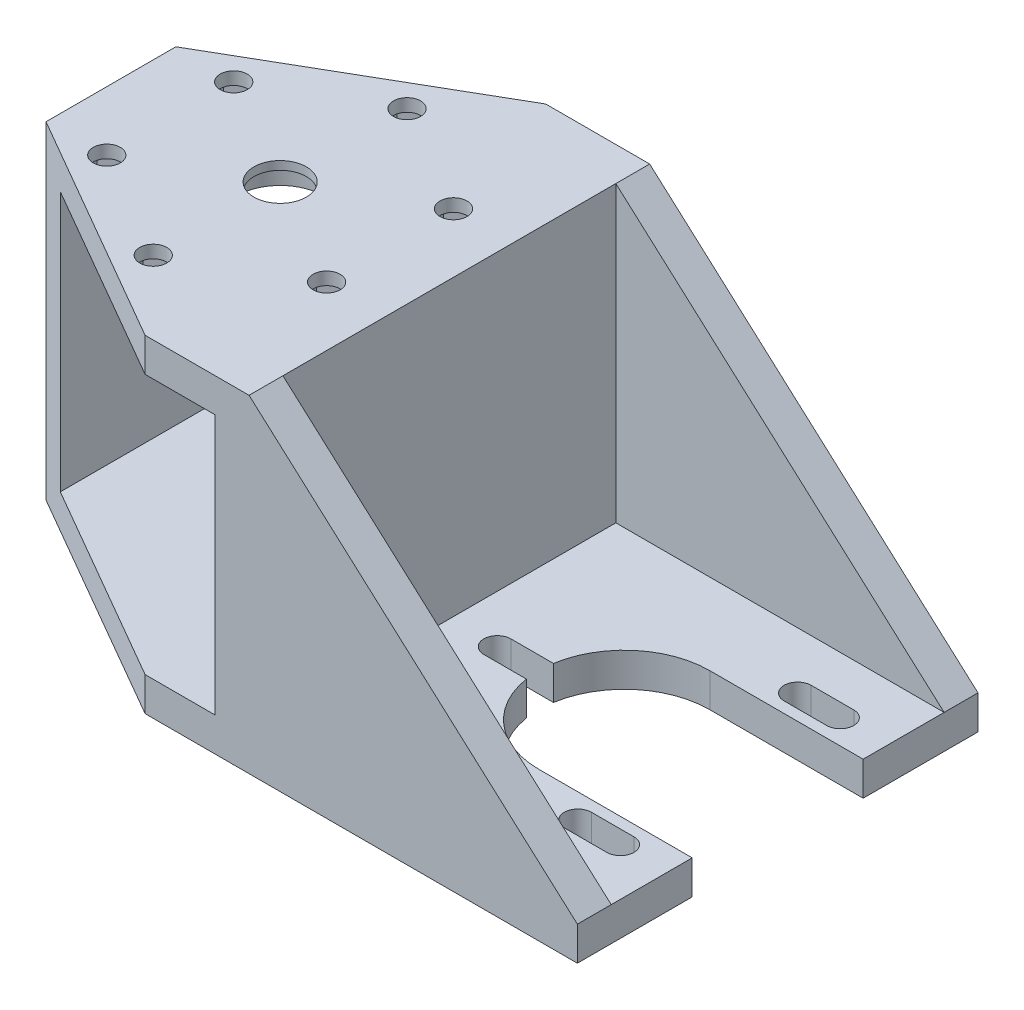
from build123d import *

# Parameters (mm, degrees)
BOSS_EXTRUDE1_DEPTH     = 39.35
CUT_EXTRUDE2_DEPTH      = 33.73
CUT_EXTRUDE2_DEPTH_BACK = 3
SKETCH3_R               = 5.15
CUT_EXTRUDE3_DEPTH      = 33.73
CUT_EXTRUDE4_DEPTH      = 87.647311883
CUT_EXTRUDE4_DEPTH_BACK = 87.647311883
SKETCH3_5_R             = 3.1
SKETCH3_5_R_2           = 10.1
SKETCH3_5_R_3           = 1.6
SKETCH3_5_W             = 20.675
SKETCH3_5_H             = 20.2
SKETCH3_5_W_2           = 5.027537917
SKETCH3_5_H_2           = 3.2
SKETCH3_5_W_3           = 5.03
SKETCH3_6_R             = 1.6
CUT_EXTRUDE5_DEPTH      = 87.647311883
BOSS_EXTRUDE2_DEPTH     = 4
BOSS_EXTRUDE3_DEPTH     = 4
CUT_EXTRUDE6_DEPTH      = 92.909209967
CUT_EXTRUDE6_DEPTH_BACK = 92.909209967
CUT_EXTRUDE7_DEPTH      = 2.5
SKETCH10_W              = 47.35
SKETCH10_H              = 38.73
BOSS_EXTRUDE5_DEPTH     = 4
CHAMFER3_SIZE           = 16
CHAMFER3_SIZE_2         = 27.712812921


with BuildPart() as part:
    # Sketch1 → Boss-Extrude1 (new body)
    with BuildSketch(Plane.XY):
        Polygon((-68.943174111, 38.106680783), (-32.943174111, 38.106680783), (-32.943174111, 3.376680783), (8.406825889, 3.376680783), (8.406825889, -0.623319217), (-68.943174111, -0.623319217), (-68.943174111, 3.376680783), (-36.943174111, 3.376680783), (-36.943174111, 34.106680783), (-68.943174111, 34.106680783), align=None)
    extrude(amount=BOSS_EXTRUDE1_DEPTH)

    # Sketch3 → Cut-Extrude2 (cut, two sides: drawn at the far end of the back side and taken through both)
    with BuildSketch(Plane(origin=(0, 3.376680783, 0), x_dir=(1, 0, 0), z_dir=(0, 1, 0)).offset(-CUT_EXTRUDE2_DEPTH_BACK)):
        with Locations(Location((-52.943174111, -19.675, 0), (0, 0, 90))):
            Circle(SKETCH3_R)
    extrude(amount=CUT_EXTRUDE2_DEPTH + CUT_EXTRUDE2_DEPTH_BACK, mode=Mode.SUBTRACT)

    # Sketch3<4> → Cut-Extrude3 (cut)
    with BuildSketch(Plane(origin=(0, 3.376680783, 0), x_dir=(1, 0, 0), z_dir=(0, 1, 0))):
        with BuildLine():
            Line((-47.611429556, -21.025), (-45.3116605, -21.025))
            Line((-45.3116605, -21.025), (-45.3116605, -18.325))
            Line((-45.3116605, -18.325), (-47.611429556, -18.325))
            ThreePointArc((-47.611429556, -18.325), (-47.485400066, -18.994777629), (-47.443174111, -19.675))
            ThreePointArc((-47.443174111, -19.675), (-47.485400066, -20.355222371), (-47.611429556, -21.025))
        make_face()
        with BuildLine():
            Line((-60.574687722, -18.325), (-60.574687722, -21.025))
            Line((-60.574687722, -21.025), (-58.274918666, -21.025))
            ThreePointArc((-58.274918666, -21.025), (-58.443174111, -19.675), (-58.274918666, -18.325))
            Line((-58.274918666, -18.325), (-60.574687722, -18.325))
        make_face()
    extrude(amount=CUT_EXTRUDE3_DEPTH, mode=Mode.SUBTRACT)

    # Sketch3<5> → Cut-Extrude4 (cut, two sides: drawn at the far end of the back side and taken through both)
    with BuildSketch(Plane(origin=(0, 3.376680783, 0), x_dir=(1, 0, 0), z_dir=(0, 1, 0)).offset(-CUT_EXTRUDE4_DEPTH_BACK)):
        with Locations(Location((-52.943174111, -19.675, 0), (0, 0, 270))):
            Circle(SKETCH3_5_R)
        with Locations((-12.268174111, -19.675)):
            Circle(SKETCH3_5_R_2)
        with Locations((-4.768174111, -32.665381057)):
            Circle(SKETCH3_5_R_3)
        with Locations((-4.768174111, -6.684618943)):
            Circle(SKETCH3_5_R_3)
        with Locations((-27.268174111, -19.675)):
            Circle(SKETCH3_5_R_3)
        with Locations((0.261825889, -32.665381057)):
            Circle(SKETCH3_5_R_3)
        with Locations((0.261825889, -6.684618943)):
            Circle(SKETCH3_5_R_3)
        with Locations((-1.930674111, -19.675)):
            Rectangle(SKETCH3_5_W, SKETCH3_5_H)
        with Locations((-24.754405152, -19.675)):
            Rectangle(SKETCH3_5_W_2, SKETCH3_5_H_2)
        with Locations((-2.253174111, -32.665381057)):
            Rectangle(SKETCH3_5_W_3, SKETCH3_5_H_2)
        with Locations((-2.253174111, -6.684618943)):
            Rectangle(SKETCH3_5_W_3, SKETCH3_5_H_2)
    extrude(amount=CUT_EXTRUDE4_DEPTH + CUT_EXTRUDE4_DEPTH_BACK, mode=Mode.SUBTRACT)

    # Sketch3<6> → Cut-Extrude5 (cut, through all)
    with BuildSketch(Plane(origin=(0, 3.376680783, 0), x_dir=(1, 0, 0), z_dir=(0, 1, 0))):
        with Locations(Location((-52.943174111, -34.675, 0), (0, 0, 180))):
            Circle(SKETCH3_6_R)
        with Locations(Location((-65.933555168, -27.175, 0), (0, 0, 180))):
            Circle(SKETCH3_6_R)
        with Locations(Location((-65.933555168, -12.175, 0), (0, 0, 180))):
            Circle(SKETCH3_6_R)
        with Locations(Location((-52.943174111, -4.675, 0), (0, 0, 180))):
            Circle(SKETCH3_6_R)
        with Locations(Location((-39.952793054, -12.175, 0), (0, 0, 180))):
            Circle(SKETCH3_6_R)
        with Locations(Location((-39.952793054, -27.175, 0), (0, 0, 180))):
            Circle(SKETCH3_6_R)
    extrude(amount=CUT_EXTRUDE5_DEPTH, mode=Mode.SUBTRACT)

    # Sketch4 → Boss-Extrude2 (add)
    with BuildSketch(Plane.XY.offset(39.35)):
        Polygon((-68.943174111, 38.106680783), (-68.943174111, 34.106680783), (-36.943174111, 34.106680783), (-36.943174111, 3.376680783), (-68.943174111, 3.376680783), (-68.943174111, -0.623319217), (8.406825889, -0.623319217), (8.406825889, 38.106680783), align=None)
    extrude(amount=BOSS_EXTRUDE2_DEPTH)

    # Sketch5 → Boss-Extrude3 (add)
    with BuildSketch(Plane(origin=(0, 0, 0), x_dir=(-1, 0, 0), z_dir=(0, 0, -1))):
        Polygon((68.943174111, 38.106680783), (68.943174111, 34.106680783), (36.943174111, 34.106680783), (36.943174111, 3.376680783), (68.943174111, 3.376680783), (68.943174111, -0.623319217), (-8.406825889, -0.623319217), (-8.406825889, 38.106680783), align=None)
    extrude(amount=BOSS_EXTRUDE3_DEPTH)

    # Sketch6 → Cut-Extrude6 (cut, two sides: drawn at the far end of the back side and taken through both)
    with BuildSketch(Plane.XY.offset(43.35).offset(-CUT_EXTRUDE6_DEPTH_BACK)):
        Polygon((-32.943174111, 38.106680783), (5.861825889, 3.376680783), (5.861825889, -0.623319217), (8.406825889, -0.623319217), (8.406825889, 38.106680783), align=None)
    extrude(amount=CUT_EXTRUDE6_DEPTH + CUT_EXTRUDE6_DEPTH_BACK, mode=Mode.SUBTRACT)

    # Sketch8 → Cut-Extrude7 (cut)
    with BuildSketch(Plane.XZ.offset(-34.106680783)):
        Polygon((-65.933555168, 15.408161507), (-68.733555168, 13.791580754), (-68.733555168, 10.558419246), (-65.933555168, 8.941838493), (-63.133555168, 10.558419246), (-63.133555168, 13.791580754), align=None)
        Polygon((-65.933555168, 30.408161507), (-68.733555168, 28.791580754), (-68.733555168, 25.558419246), (-65.933555168, 23.941838493), (-63.133555168, 25.558419246), (-63.133555168, 28.791580754), align=None)
        Polygon((-52.943174111, 1.441838493), (-50.143174111, 3.058419246), (-50.143174111, 6.291580754), (-52.943174111, 7.908161507), (-55.743174111, 6.291580754), (-55.743174111, 3.058419246), align=None)
        Polygon((-39.952793054, 8.941838493), (-37.152793054, 10.558419246), (-37.152793054, 13.791580754), (-39.952793054, 15.408161507), (-42.752793054, 13.791580754), (-42.752793054, 10.558419246), align=None)
        Polygon((-39.952793054, 23.941838493), (-37.152793054, 25.558419246), (-37.152793054, 28.791580754), (-39.952793054, 30.408161507), (-42.752793054, 28.791580754), (-42.752793054, 25.558419246), align=None)
        Polygon((-52.943174111, 37.908161507), (-55.743174111, 36.291580754), (-55.743174111, 33.058419246), (-52.943174111, 31.441838493), (-50.143174111, 33.058419246), (-50.143174111, 36.291580754), align=None)
    extrude(amount=-CUT_EXTRUDE7_DEPTH, mode=Mode.SUBTRACT)

    # Sketch10 → Boss-Extrude5 (add)
    with BuildSketch(Plane.ZY.offset(68.943174111)):
        with Locations((19.675, 18.741680783)):
            Rectangle(SKETCH10_W, SKETCH10_H)
    extrude(amount=BOSS_EXTRUDE5_DEPTH)

    # Chamfer3
    # the kernel refuses this chamfer: 27.712812921, 16 mm, written as the material it takes off along each edge
    with BuildSketch(Plane(origin=(-72.943174111, -72.318742746, -4), x_dir=(-0.05789386240267147, 0, 0.9983227437537926), z_dir=(0, 1, 0))) as chamfer3_piece_1:
        Polygon((CHAMFER3_SIZE * 0.998322743754, CHAMFER3_SIZE * 0.0578938624027), (-CHAMFER3_SIZE_2 * 0.0578938624029, CHAMFER3_SIZE_2 * 0.998322743757), (0, 0), align=None)
    extrude(amount=182.120847059, mode=Mode.SUBTRACT)
    with BuildSketch(Plane(origin=(-72.943174111, 109.802104312, 43.35), x_dir=(0.9998132206222079, 0, 0.019326765612700702), z_dir=(0, -1, 0))) as chamfer3_piece_2:
        Polygon((CHAMFER3_SIZE_2 * 0.999813220626, -CHAMFER3_SIZE_2 * 0.0193267656128), (-CHAMFER3_SIZE * 0.0193267656127, -CHAMFER3_SIZE * 0.999813220622), (0, 0), align=None)
    extrude(amount=182.120847059, mode=Mode.SUBTRACT)


solid = part.part
